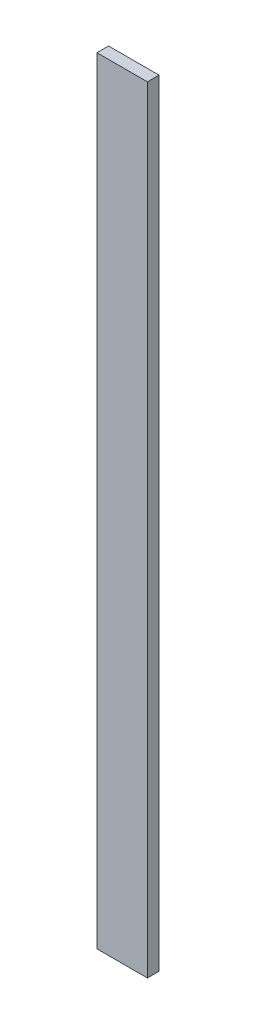
from build123d import *

# Parameters (mm, degrees)
SKETCH1_W   = 195
SKETCH1_H   = 45
SHAPE_DEPTH = 3000


with BuildPart() as part:
    # Sketch1 → Shape (new body)
    with BuildSketch(Plane(origin=(0, 0, 0), x_dir=(1, 0, 0), z_dir=(0, 1, 0))):
        Rectangle(SKETCH1_W, SKETCH1_H)
    extrude(amount=SHAPE_DEPTH)


solid = part.part
